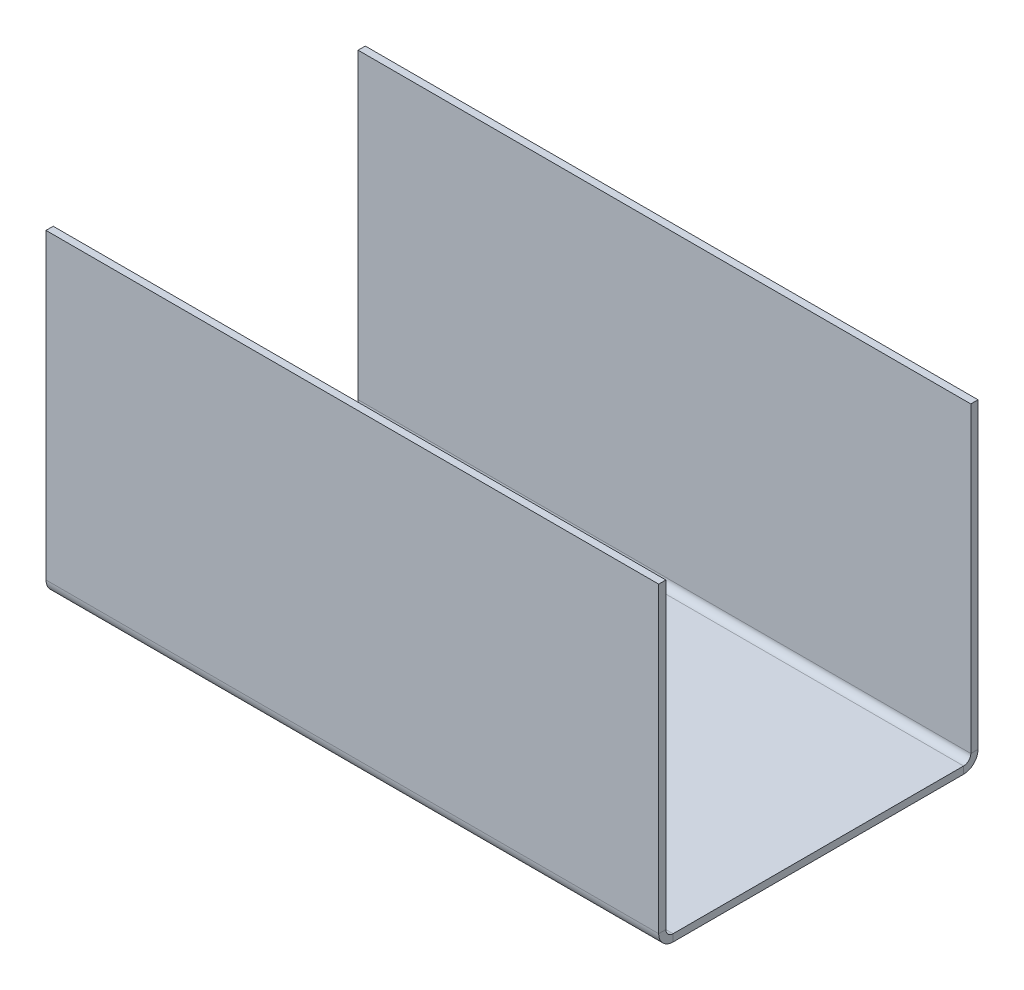
from build123d import *

# Parameters (mm, degrees)
SZKIC2_W                    = 85
SZKIC2_H                    = 44.3
DODANIE_WYCI_GNI_CIE1_DEPTH = 1
SZKIC7_W                    = 85
SZKIC7_H                    = 1
DODANIE_WYCI_GNI_CIE2_DEPTH = 43
KONWERTUJ_START             = -42.5
KONWERTUJ_BRY_1_DEPTH       = 85
KONWERTUJ_BRY_1_2_DEPTH     = 85


# Read off the part's stored shape, not the designer's step: Konwertuj bryłę1
with BuildPart() as part:
    # Szkic2 → Dodanie-wyciągnięcie1 (new body)
    with BuildSketch(Plane(origin=(0, 0, 0), x_dir=(1, 0, 0), z_dir=(0, 1, 0))):
        Rectangle(SZKIC2_W, SZKIC2_H)
    extrude(amount=DODANIE_WYCI_GNI_CIE1_DEPTH)

    # Szkic7 → Dodanie-wyciągnięcie2 (add)
    with BuildSketch(Plane(origin=(0, 1, 0), x_dir=(1, 0, 0), z_dir=(0, 1, 0))):
        with Locations((0, 21.65)):
            Rectangle(SZKIC7_W, SZKIC7_H)
        with Locations((0, -21.65)):
            Rectangle(SZKIC7_W, SZKIC7_H)
    extrude(amount=DODANIE_WYCI_GNI_CIE2_DEPTH)

    # Konwertuj bryłę1 outline → Konwertuj bryłę1 (cut)
    with BuildSketch(Plane.YZ.offset(KONWERTUJ_START)):
        with BuildLine():
            ThreePointArc((2, -22.15), (0.585786438, -21.564213562), (0, -20.15))
            Line((0, -20.15), (0, -22.15))
            Line((0, -22.15), (2, -22.15))
        make_face()
        with BuildLine():
            ThreePointArc((0, 20.15), (0.585786438, 21.564213562), (2, 22.15))
            Line((2, 22.15), (0, 22.15))
            Line((0, 22.15), (0, 20.15))
        make_face()
    extrude(amount=KONWERTUJ_BRY_1_DEPTH, mode=Mode.SUBTRACT)

    # Konwertuj bry_1 2 outline → Konwertuj bry_1 2 (add)
    with BuildSketch(Plane.YZ.offset(KONWERTUJ_START)):
        with BuildLine():
            ThreePointArc((2, -21.15), (1.292893219, -20.857106781), (1, -20.15))
            Line((1, -20.15), (1, -21.15))
            Line((1, -21.15), (2, -21.15))
        make_face()
        with BuildLine():
            ThreePointArc((1, 20.15), (1.292893219, 20.857106781), (2, 21.15))
            Line((2, 21.15), (1, 21.15))
            Line((1, 21.15), (1, 20.15))
        make_face()
    extrude(amount=KONWERTUJ_BRY_1_2_DEPTH)


solid = part.part
